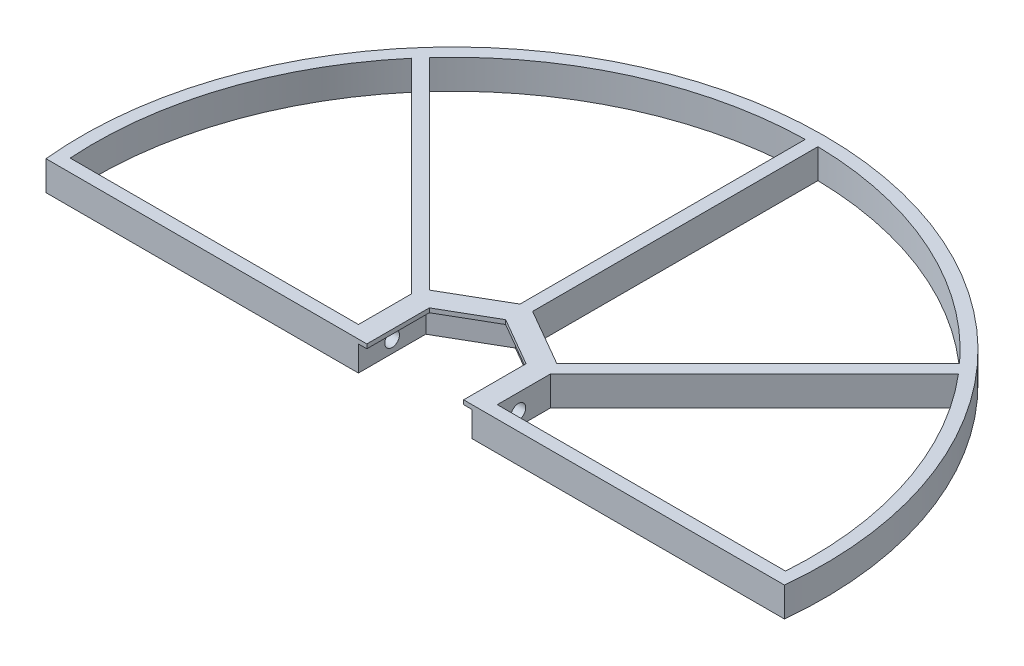
from build123d import *

# Parameters (mm, degrees)
BOSS_EXTRUDE2_DEPTH                = 7
SKETCH3_W                          = 27
SKETCH3_H                          = 3
CUT_EXTRUDE2_DEPTH                 = 10
F_3_5_START                        = -16.5
F_3_5_3_5_DIAMETER_HOLE1_OUTLINE_R = 1.75
F_3_5_3_5_DIAMETER_HOLE1_DEPTH     = 33
BOSS_EXTRUDE4_DEPTH                = 1


# Read off the part's stored shape, not the designer's step: Ø3.5 (3.5) Diameter Hole1
with BuildPart() as part:
    # Sketch1 → Boss-Extrude2 (new body)
    # profile 1 of 5: a face of its own
    with BuildSketch(Plane(origin=(0, 0, 0), x_dir=(1, 0, 0), z_dir=(0, 1, 0))):
        with BuildLine():
            ThreePointArc((87.751176684, -3), (0, 94.211501571), (-87.751176684, -3))
            Line((-87.751176684, -3), (87.751176684, -3))
        make_face()
        with BuildLine():
            Line((-16.5, 0), (-85, 0))
            ThreePointArc((-85, 0), (-80.982173458, 32.512027121), (-64.995192411, 61.105580148))
            ThreePointArc((-64.995192411, 61.105580148), (-64.013019257, 62.243518432), (-63.01092574, 63.363954164))
            ThreePointArc((-63.01092574, 63.363954164), (-35.129795909, 83.633095001), (-1.5, 91.198298105))
            ThreePointArc((-1.5, 91.198298105), (0, 91.211501571), (1.5, 91.198298105))
            ThreePointArc((1.5, 91.198298105), (35.129795909, 83.633095001), (63.01092574, 63.363954164))
            ThreePointArc((63.01092574, 63.363954164), (64.013019257, 62.243518432), (64.995192411, 61.105580148))
            ThreePointArc((64.995192411, 61.105580148), (80.982173458, 32.512027121), (85, 0))
            Line((85, 0), (16.5, 0))
            Line((16.5, 0), (13.5, 0))
            Line((13.5, 0), (-13.5, 0))
            Line((-13.5, 0), (-16.5, 0))
        make_face(mode=Mode.SUBTRACT)
    # profile 2 of 5: a face of its own
    with BuildSketch(Plane(origin=(0, 0, 0), x_dir=(1, 0, 0), z_dir=(0, 1, 0))):
        with BuildLine():
            Line((16.5, 14.73170808), (16.5, 12.610387736))
            Line((16.5, 12.610387736), (64.995192411, 61.105580148))
            ThreePointArc((64.995192411, 61.105580148), (64.013019257, 62.243518432), (63.01092574, 63.363954164))
            Line((63.01092574, 63.363954164), (15.155331601, 15.508360024))
            Line((15.155331601, 15.508360024), (16.5, 14.73170808))
        make_face()
    # profile 3 of 5: a face of its own
    with BuildSketch(Plane(origin=(0, 0, 0), x_dir=(1, 0, 0), z_dir=(0, 1, 0))):
        with BuildLine():
            ThreePointArc((1.5, 91.198298105), (0, 91.211501571), (-1.5, 91.198298105))
            Line((-1.5, 91.198298105), (-1.5, 23.395389902))
            Line((-1.5, 23.395389902), (0, 24.261758084))
            Line((0, 24.261758084), (1.5, 23.395389902))
            Line((1.5, 23.395389902), (1.5, 91.198298105))
        make_face()
    # profile 4 of 5: a face of its own
    with BuildSketch(Plane(origin=(0, 0, 0), x_dir=(1, 0, 0), z_dir=(0, 1, 0))):
        with BuildLine():
            ThreePointArc((-63.01092574, 63.363954164), (-64.013019257, 62.243518432), (-64.995192411, 61.105580148))
            Line((-64.995192411, 61.105580148), (-16.5, 12.610387736))
            Line((-16.5, 12.610387736), (-16.5, 14.73170808))
            Line((-16.5, 14.73170808), (-15.155331601, 15.508360024))
            Line((-15.155331601, 15.508360024), (-63.01092574, 63.363954164))
        make_face()
    # profile 5 of 5: a face of its own
    with BuildSketch(Plane(origin=(0, 0, 0), x_dir=(1, 0, 0), z_dir=(0, 1, 0))):
        Polygon((-16.5, 12.610387736), (-16.5, 0), (-13.5, 0), (-13.5, 13), (0, 20.79731364), (13.5, 13), (13.5, 0), (16.5, 0), (16.5, 12.610387736), (16.5, 14.73170808), (15.155331601, 15.508360024), (1.5, 23.395389902), (0, 24.261758084), (-1.5, 23.395389902), (-15.155331601, 15.508360024), (-16.5, 14.73170808), align=None)
    extrude(amount=BOSS_EXTRUDE2_DEPTH)

    # Sketch3 → Cut-Extrude2 (cut)
    with BuildSketch(Plane(origin=(0, 7, 0), x_dir=(1, 0, 0), z_dir=(0, 1, 0))):
        with Locations((0, -1.5)):
            Rectangle(SKETCH3_W, SKETCH3_H)
    extrude(amount=-CUT_EXTRUDE2_DEPTH, mode=Mode.SUBTRACT)

    # Ø3.5 (3.5) Diameter Hole1 outline → Ø3.5 (3.5) Diameter Hole1 (cut)
    with BuildSketch(Plane.YZ.offset(F_3_5_START)):
        with Locations((3, -5.010387736)):
            Circle(F_3_5_3_5_DIAMETER_HOLE1_OUTLINE_R)
    extrude(amount=F_3_5_3_5_DIAMETER_HOLE1_DEPTH, mode=Mode.SUBTRACT)

    # Sketch6 → Boss-Extrude4 (add)
    with BuildSketch(Plane(origin=(0, 7, 0), x_dir=(1, 0, 0), z_dir=(0, 1, 0))):
        Polygon((11.5, 11.845527947), (11.5, -3), (13.5, -3), (13.5, 13), (0, 20.79731364), (-13.5, 13), (-13.5, -3), (-11.5, -3), (-11.5, 11.845527947), (0, 18.48768401), align=None)
    extrude(amount=-BOSS_EXTRUDE4_DEPTH)


solid = part.part
